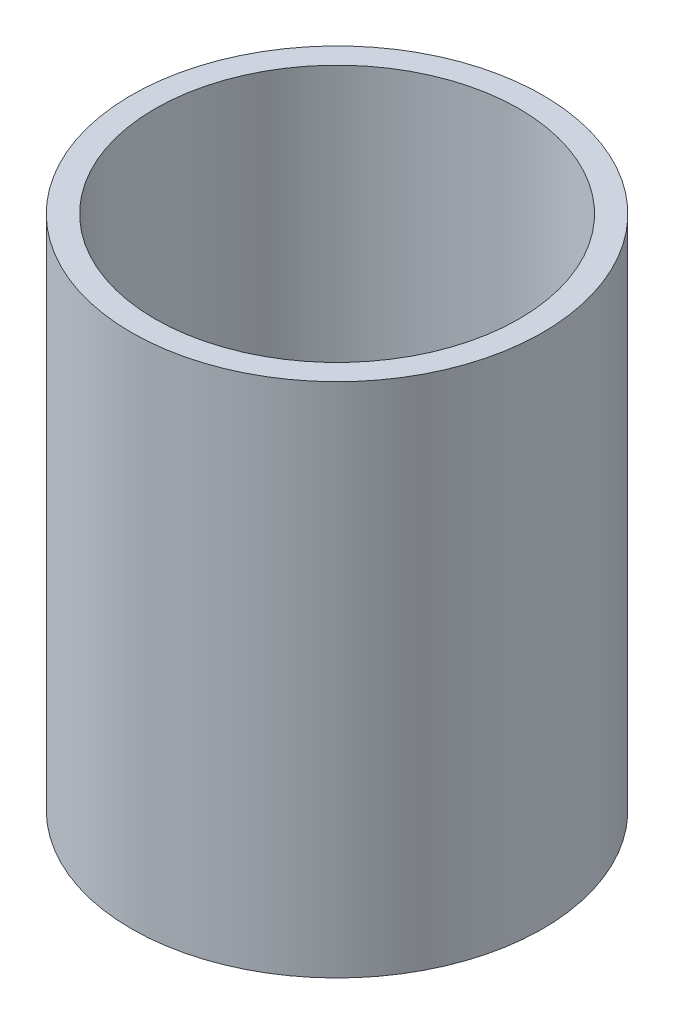
from build123d import *

# Parameters (mm, degrees)
SKETCH1_R           = 55
BOSS_EXTRUDE1_DEPTH = 138.118839335
SKETCH2_R           = 48.696767732
CUT_EXTRUDE1_DEPTH  = 159.514396126


with BuildPart() as part:
    # Sketch1 → Boss-Extrude1 (new body)
    with BuildSketch(Plane(origin=(0, 0, 0), x_dir=(1, 0, 0), z_dir=(0, 1, 0))):
        Circle(SKETCH1_R)
    extrude(amount=BOSS_EXTRUDE1_DEPTH)

    # Sketch2 → Cut-Extrude1 (cut, through all)
    with BuildSketch(Plane(origin=(0, 0, 0), x_dir=(1, 0, 0), z_dir=(0, 1, 0))):
        Circle(SKETCH2_R)
    extrude(amount=CUT_EXTRUDE1_DEPTH, mode=Mode.SUBTRACT)


solid = part.part
